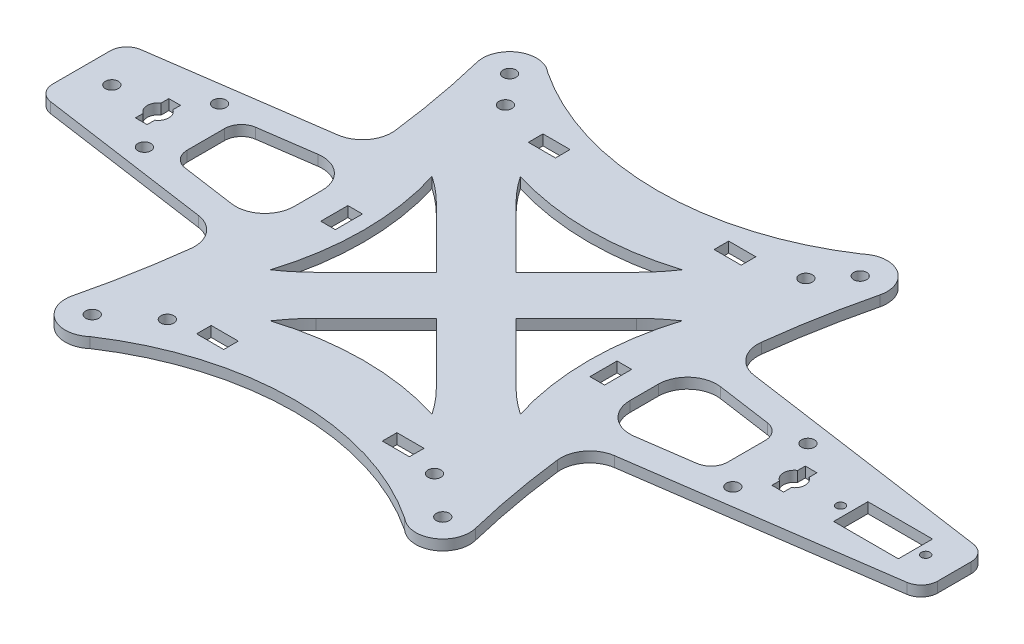
from build123d import *

# Parameters (mm, degrees)
SKETCH_1_R      = 1.55
SKETCH_1_R_2    = 1.05
SKETCH_1_W      = 6.5
SKETCH_1_H      = 3.5
SKETCH_1_W_2    = 3.5
SKETCH_1_H_2    = 6.5
SKETCH_1_W_3    = 15.5
SKETCH_1_H_3    = 8.2
EXTRUDE_1_DEPTH = 2.5
FILLET_1_R      = 4
FILLET_2_R      = 7


with BuildPart() as part:
    # 草图1 → 凸台-拉伸1 (new body)
    with BuildSketch(Plane(origin=(0, 0, 0), x_dir=(1, 0, 0), z_dir=(0, 1, 0))):
        with BuildLine():
            Line((114.591143215, 7.468307572), (114.591143215, -7.468307572))
            Line((114.591143215, -7.468307572), (43.193640968, -17.646273029))
            ThreePointArc((43.193640968, -17.646273029), (45.143245402, -33.15226541), (48.27557779, -48.463217404))
            ThreePointArc((48.27557779, -48.463217404), (45.335063646, -55.533708325), (37.709796983, -54.831018053))
            ThreePointArc((37.709796983, -54.831018053), (0, -43.436211003), (-37.709796983, -54.831018053))
            ThreePointArc((-37.709796983, -54.831018053), (-45.335063646, -55.533708325), (-48.27557779, -48.463217404))
            ThreePointArc((-48.27557779, -48.463217404), (-45.143245402, -33.15226541), (-43.193640968, -17.646273029))
            Line((-43.193640968, -17.646273029), (-94.579518436, -10.321035179))
            Line((-94.579518436, -10.321035179), (-94.579518436, 10.321035179))
            Line((-94.579518436, 10.321035179), (-43.193640968, 17.646273029))
            ThreePointArc((-43.193640968, 17.646273029), (-45.143245402, 33.15226541), (-48.27557779, 48.463217404))
            ThreePointArc((-48.27557779, 48.463217404), (-45.335063646, 55.533708325), (-37.709796983, 54.831018053))
            ThreePointArc((-37.709796983, 54.831018053), (0, 43.436211003), (37.709796983, 54.831018053))
            ThreePointArc((37.709796983, 54.831018053), (45.335063646, 55.533708325), (48.27557779, 48.463217404))
            ThreePointArc((48.27557779, 48.463217404), (45.143245402, 33.15226541), (43.193640968, 17.646273029))
            Line((43.193640968, 17.646273029), (114.591143215, 7.468307572))
        make_face()
        with Locations((-36, 43)):
            Circle(SKETCH_1_R, mode=Mode.SUBTRACT)
        with Locations((-32, -42)):
            Circle(SKETCH_1_R, mode=Mode.SUBTRACT)
        with Locations((32, -42)):
            Circle(SKETCH_1_R, mode=Mode.SUBTRACT)
        with Locations((36, 43)):
            Circle(SKETCH_1_R, mode=Mode.SUBTRACT)
        with Locations((42, 50)):
            Circle(SKETCH_1_R, mode=Mode.SUBTRACT)
        with Locations((42, -50)):
            Circle(SKETCH_1_R, mode=Mode.SUBTRACT)
        with Locations((-42, -50)):
            Circle(SKETCH_1_R, mode=Mode.SUBTRACT)
        with Locations((-42, 50)):
            Circle(SKETCH_1_R, mode=Mode.SUBTRACT)
        with Locations((107.7, 0)):
            Circle(SKETCH_1_R_2, mode=Mode.SUBTRACT)
        with Locations((87.3, 0)):
            Circle(SKETCH_1_R_2, mode=Mode.SUBTRACT)
        with Locations((70.5, 9)):
            Circle(SKETCH_1_R, mode=Mode.SUBTRACT)
        with Locations((70.5, -9)):
            Circle(SKETCH_1_R, mode=Mode.SUBTRACT)
        with Locations((-70.5, -9)):
            Circle(SKETCH_1_R, mode=Mode.SUBTRACT)
        with Locations((-70.5, 9)):
            Circle(SKETCH_1_R, mode=Mode.SUBTRACT)
        with Locations((-87.3, 0)):
            Circle(SKETCH_1_R, mode=Mode.SUBTRACT)
        with Locations((-22.25, 39.75)):
            Rectangle(SKETCH_1_W, SKETCH_1_H, mode=Mode.SUBTRACT)
        with Locations((-32.25, 0)):
            Rectangle(SKETCH_1_W_2, SKETCH_1_H_2, mode=Mode.SUBTRACT)
        with Locations((-22.25, -39.75)):
            Rectangle(SKETCH_1_W, SKETCH_1_H, mode=Mode.SUBTRACT)
        with Locations((22.25, 39.75)):
            Rectangle(SKETCH_1_W, SKETCH_1_H, mode=Mode.SUBTRACT)
        with Locations((22.25, -39.75)):
            Rectangle(SKETCH_1_W, SKETCH_1_H, mode=Mode.SUBTRACT)
        with Locations((32.25, 0)):
            Rectangle(SKETCH_1_W_2, SKETCH_1_H_2, mode=Mode.SUBTRACT)
        with BuildLine():
            Line((77.65, -2.151778405), (77.65, -4))
            Line((77.65, -4), (74.85, -4))
            Line((74.85, -4), (74.85, -2.176778405))
            ThreePointArc((74.85, -2.176778405), (73.652957971, 0), (74.85, 2.176778405))
            Line((74.85, 2.176778405), (74.85, 4))
            Line((74.85, 4), (77.65, 4))
            Line((77.65, 4), (77.65, 2.151778405))
            ThreePointArc((77.65, 2.151778405), (78.8083942, 0), (77.65, -2.151778405))
        make_face(mode=Mode.SUBTRACT)
        with Locations((97.5, 0)):
            Rectangle(SKETCH_1_W_3, SKETCH_1_H_3, mode=Mode.SUBTRACT)
        with BuildLine():
            Line((-74.85, -2.176778405), (-74.85, -4))
            Line((-74.85, -4), (-77.65, -4))
            Line((-77.65, -4), (-77.65, -2.151778405))
            ThreePointArc((-77.65, -2.151778405), (-78.8083942, 0), (-77.65, 2.151778405))
            Line((-77.65, 2.151778405), (-77.65, 4))
            Line((-77.65, 4), (-74.85, 4))
            Line((-74.85, 4), (-74.85, 2.176778405))
            ThreePointArc((-74.85, 2.176778405), (-73.652957971, 0), (-74.85, -2.176778405))
        make_face(mode=Mode.SUBTRACT)
        with BuildLine():
            Line((-23.978041684, 14.429581723), (-9.54845996, 0))
            Line((-9.54845996, 0), (-23.978041684, -14.429581723))
            ThreePointArc((-23.978041684, -14.429581723), (-26.851664039, -17.042325553), (-29.960234119, -19.370614155))
            ThreePointArc((-29.960234119, -19.370614155), (-27.006361348, 0), (-29.960234119, 19.370614155))
            ThreePointArc((-29.960234119, 19.370614155), (-26.851664039, 17.042325553), (-23.978041684, 14.429581723))
        make_face(mode=Mode.SUBTRACT)
        with BuildLine():
            Line((14.429581723, 23.978041684), (0, 9.54845996))
            Line((0, 9.54845996), (-14.429581723, 23.978041684))
            ThreePointArc((-14.429581723, 23.978041684), (-17.042325553, 26.851664039), (-19.370614155, 29.960234119))
            ThreePointArc((-19.370614155, 29.960234119), (0, 27.006361348), (19.370614155, 29.960234119))
            ThreePointArc((19.370614155, 29.960234119), (17.042325553, 26.851664039), (14.429581723, 23.978041684))
        make_face(mode=Mode.SUBTRACT)
        with BuildLine():
            Line((23.978041684, -14.429581723), (9.54845996, 0))
            Line((9.54845996, 0), (23.978041684, 14.429581723))
            ThreePointArc((23.978041684, 14.429581723), (26.851664039, 17.042325553), (29.960234119, 19.370614155))
            ThreePointArc((29.960234119, 19.370614155), (27.006361348, 0), (29.960234119, -19.370614155))
            ThreePointArc((29.960234119, -19.370614155), (26.851664039, -17.042325553), (23.978041684, -14.429581723))
        make_face(mode=Mode.SUBTRACT)
        with BuildLine():
            Line((-14.429581723, -23.978041684), (0, -9.54845996))
            Line((0, -9.54845996), (14.429581723, -23.978041684))
            ThreePointArc((14.429581723, -23.978041684), (17.042325553, -26.851664039), (19.370614155, -29.960234119))
            ThreePointArc((19.370614155, -29.960234119), (0, -27.006361348), (-19.370614155, -29.960234119))
            ThreePointArc((-19.370614155, -29.960234119), (-17.042325553, -26.851664039), (-14.429581723, -23.978041684))
        make_face(mode=Mode.SUBTRACT)
        Polygon((-64.75, -7.957119899), (-64.75, 7.957119899), (-40.25, 11.449681205), (-40.25, -11.449681205), align=None, mode=Mode.SUBTRACT)
        Polygon((64.75, 7.957119899), (40.25, 11.449681205), (40.25, -11.449681205), (64.75, -7.957119899), align=None, mode=Mode.SUBTRACT)
    extrude(amount=EXTRUDE_1_DEPTH)

    # 圆角1
    fillet_1_edges = [part.edges().sort_by_distance(p)[0] for p in [
        (114.591143215, 1.25, -7.468307572),
        (114.591143215, 1.25, 7.468307572),
        (-94.579518436, 1.25, 10.321035179),
        (-94.579518436, 1.25, -10.321035179),
        (-64.75, 1.25, 7.957119899),
        (-64.75, 1.25, -7.957119899),
        (64.75, 1.25, 7.957119899),
        (64.75, 1.25, -7.957119899),
    ]]
    fillet(fillet_1_edges, radius=FILLET_1_R)

    # 圆角2
    fillet_2_edges = [part.edges().sort_by_distance(p)[0] for p in [
        (43.193640968, 1.25, -17.646273029),
        (43.193640968, 1.25, 17.646273029),
        (-43.193640968, 1.25, 17.646273029),
        (-43.193640968, 1.25, -17.646273029),
        (40.25, 1.25, 11.449681205),
        (40.25, 1.25, -11.449681205),
        (-40.25, 1.25, 11.449681205),
        (-40.25, 1.25, -11.449681205),
    ]]
    fillet(fillet_2_edges, radius=FILLET_2_R)


solid = part.part
